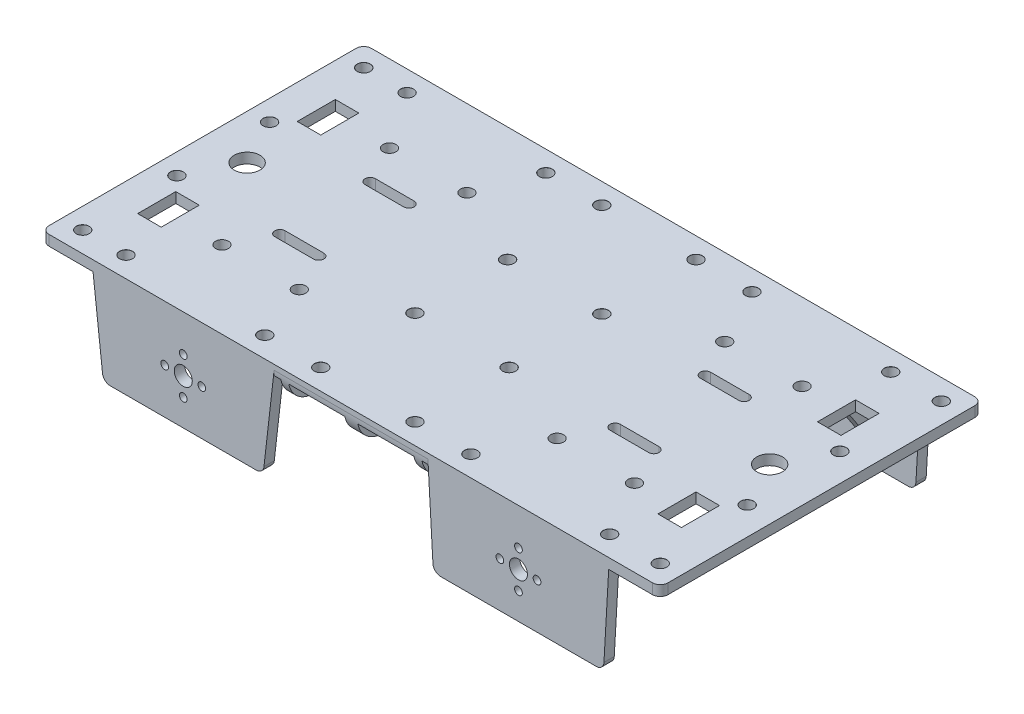
from build123d import *

# Parameters (mm, degrees)
EXTRUDE_1_DEPTH                 = 4
EXTRUDE_1_DEPTH_BACK            = 0.001
SKETCH_2_W                      = 240
SKETCH_2_H                      = 125
FILLET_1_R                      = 3
SKETCH_4_W                      = 70
SKETCH_4_H                      = 4
EXTRUDE_3_DEPTH                 = 35
CUT_EXTRUDE_1_DEPTH             = 177.776893289
CUT_EXTRUDE_1_DEPTH_BACK        = 177.776893289
CUT_EXTRUDE_2_DEPTH             = 177.776893289
CUT_EXTRUDE_2_DEPTH_BACK        = 177.776893289
FILLET_2_R                      = 3
FILLET_3_R                      = 3
CUT_EXTRUDE_4_REACH             = 142.81
SKETCH_11_R                     = 2.5
CUT_EXTRUDE_4_DIRECTION_2_DEPTH = 141.809545135
HOLE_WIZARD_5_0_5_4_D           = 5
HOLE_WIZARD_5_0_5_4_CSINK_D     = 5.05
HOLE_WIZARD_5_0_5_4_CSINK_ANGLE = 90
HOLE_WIZARD_5_0_5_5_D           = 5
HOLE_WIZARD_5_0_5_5_CSINK_D     = 5.05
HOLE_WIZARD_5_0_5_5_CSINK_ANGLE = 90
SKETCH_26_W                     = 9.130018581
SKETCH_26_H                     = 14.776214284
CUT_EXTRUDE_5_DEPTH             = 10
SKETCH_22_R                     = 5
CUT_EXTRUDE_6_DEPTH             = 10
SKETCH_29_R                     = 3.5
SKETCH_29_R_2                   = 1.5
CUT_EXTRUDE_7_DEPTH             = 177.776893289
SKETCH_30_W                     = 3.603756025
SKETCH_30_H                     = 19.855762593
EXTRUDE_4_DEPTH                 = 30
CUT_EXTRUDE_8_REACH             = 221.279
MIRROR_6_COPY_1_SKETCH_W        = 3.603756025
MIRROR_6_COPY_1_SKETCH_H        = 19.855762593
MIRROR_6_COPY_1_DEPTH           = 30
MIRROR_6_COPY_2_REACH           = 221.279
MIRROR_7_COPY_1_SKETCH_W        = 3.603756025
MIRROR_7_COPY_1_SKETCH_H        = 19.855762593
MIRROR_7_COPY_1_DEPTH           = 30
MIRROR_7_COPY_2_REACH           = 221.279
MIRROR_7_COPY_3_SKETCH_W        = 3.603756025
MIRROR_7_COPY_3_SKETCH_H        = 19.855762593
MIRROR_7_COPY_3_DEPTH           = 30
MIRROR_7_COPY_4_REACH           = 221.279
MIRROR_7_COPY_5_SKETCH_W        = 3.603756025
MIRROR_7_COPY_5_SKETCH_H        = 19.855762593
MIRROR_7_COPY_5_DEPTH           = 30
MIRROR_7_COPY_6_REACH           = 221.279
SKETCH_33_W                     = 5.04731896
SKETCH_33_H                     = 125
SKETCH_33_W_2                   = 3.106042459
EXTRUDE_5_DEPTH                 = 8
FILLET_4_R                      = 10


with BuildPart() as part:
    # 草图2 → 凸台-拉伸1 (new, two sides: drawn at the far end of the back side and taken through both)
    with BuildSketch(Plane(origin=(0, 0, 0), x_dir=(1, 0, 0), z_dir=(0, 1, 0)).offset(-EXTRUDE_1_DEPTH_BACK)):
        Rectangle(SKETCH_2_W, SKETCH_2_H)
    extrude(amount=EXTRUDE_1_DEPTH + EXTRUDE_1_DEPTH_BACK)

    # 圆角1
    fillet_1_edges = [part.edges().sort_by_distance(p)[0] for p in [
        (120, 1.9995, 62.5),
        (-120, 1.9995, 62.5),
        (-120, 1.9995, -62.5),
        (120, 1.9995, -62.5),
    ]]
    fillet(fillet_1_edges, radius=FILLET_1_R)

    # 草图4 → 凸台-拉伸3 (add)
    with BuildSketch(Plane.XZ.offset(0.001)):
        with Locations((65, 60.5)):
            Rectangle(SKETCH_4_W, SKETCH_4_H)
        with Locations((-65, 60.5)):
            Rectangle(SKETCH_4_W, SKETCH_4_H)
        with Locations((65, -60.5)):
            Rectangle(SKETCH_4_W, SKETCH_4_H)
        with Locations((-65, -60.5)):
            Rectangle(SKETCH_4_W, SKETCH_4_H)
    extrude(amount=EXTRUDE_3_DEPTH)

    # 草图7 → 切除-拉伸1 (cut, two sides: drawn at the far end of the back side and taken through both)
    with BuildSketch(Plane.XY.offset(62.5).offset(-CUT_EXTRUDE_1_DEPTH_BACK)):
        Polygon((-100, -0.001), (-96, -35.001), (-100, -35.001), align=None)
        Polygon((-30, -0.001), (-34, -35.001), (-30, -35.001), align=None)
    extrude(amount=CUT_EXTRUDE_1_DEPTH + CUT_EXTRUDE_1_DEPTH_BACK, mode=Mode.SUBTRACT)

    # 草图9 → 切除-拉伸2 (cut, two sides: drawn at the far end of the back side and taken through both)
    with BuildSketch(Plane.XY.offset(62.5).offset(-CUT_EXTRUDE_2_DEPTH_BACK)):
        Polygon((30, -0.001), (32, -35.001), (30, -35.001), align=None)
        Polygon((98, -35.001), (100, -35.001), (100, -0.001), align=None)
    extrude(amount=CUT_EXTRUDE_2_DEPTH + CUT_EXTRUDE_2_DEPTH_BACK, mode=Mode.SUBTRACT)

    # 圆角2
    fillet_2_edges = [part.edges().sort_by_distance(p)[0] for p in [
        (-96, -35.001, 60.5),
    ]]
    fillet(fillet_2_edges, radius=FILLET_2_R)

    # 圆角3
    fillet_3_edges = [part.edges().sort_by_distance(p)[0] for p in [
        (98, -35.001, -60.5),
        (32, -35.001, -60.5),
        (98, -35.001, 60.5),
        (32, -35.001, 60.5),
        (-34, -35.001, -60.5),
        (-96, -35.001, -60.5),
        (-34, -35.001, 60.5),
    ]]
    fillet(fillet_3_edges, radius=FILLET_3_R)

    # 草图11 → 切除-拉伸4 (cut, up to next)
    with BuildSketch(Plane(origin=(0, 4, 0), x_dir=(1, 0, 0), z_dir=(0, 1, 0)), mode=Mode.PRIVATE) as cut_extrude_4_sk1:
        with Locations(Location((-80, -32.5, 0), (0, 0, 90))):
            Circle(SKETCH_11_R)
    cut_extrude_4_tool1 = extrude(cut_extrude_4_sk1.sketch, amount=-CUT_EXTRUDE_4_REACH, mode=Mode.PRIVATE) & part.part
    # 草图11 → 切除-拉伸4 (cut, up to next)
    with BuildSketch(Plane(origin=(0, 4, 0), x_dir=(1, 0, 0), z_dir=(0, 1, 0)), mode=Mode.PRIVATE) as cut_extrude_4_sk2:
        with Locations(Location((-50, -32.5, 0), (0, 0, 90))):
            Circle(SKETCH_11_R)
    cut_extrude_4_tool2 = extrude(cut_extrude_4_sk2.sketch, amount=-CUT_EXTRUDE_4_REACH, mode=Mode.PRIVATE) & part.part
    # 草图11 → 切除-拉伸4 (cut, up to next)
    with BuildSketch(Plane(origin=(0, 4, 0), x_dir=(1, 0, 0), z_dir=(0, 1, 0)), mode=Mode.PRIVATE) as cut_extrude_4_sk3:
        with Locations(Location((-50, 32.5, 0), (0, 0, 90))):
            Circle(SKETCH_11_R)
    cut_extrude_4_tool3 = extrude(cut_extrude_4_sk3.sketch, amount=-CUT_EXTRUDE_4_REACH, mode=Mode.PRIVATE) & part.part
    # 草图11 → 切除-拉伸4 (cut, up to next)
    with BuildSketch(Plane(origin=(0, 4, 0), x_dir=(1, 0, 0), z_dir=(0, 1, 0)), mode=Mode.PRIVATE) as cut_extrude_4_sk4:
        with Locations(Location((-80, 32.5, 0), (0, 0, 90))):
            Circle(SKETCH_11_R)
    cut_extrude_4_tool4 = extrude(cut_extrude_4_sk4.sketch, amount=-CUT_EXTRUDE_4_REACH, mode=Mode.PRIVATE) & part.part
    # 草图11 → 切除-拉伸4 (cut, up to next)
    with BuildSketch(Plane(origin=(0, 4, 0), x_dir=(1, 0, 0), z_dir=(0, 1, 0)), mode=Mode.PRIVATE) as cut_extrude_4_sk5:
        with Locations(Location((50, -32.5, 0), (0, 0, 90))):
            Circle(SKETCH_11_R)
    cut_extrude_4_tool5 = extrude(cut_extrude_4_sk5.sketch, amount=-CUT_EXTRUDE_4_REACH, mode=Mode.PRIVATE) & part.part
    # 草图11 → 切除-拉伸4 (cut, up to next)
    with BuildSketch(Plane(origin=(0, 4, 0), x_dir=(1, 0, 0), z_dir=(0, 1, 0)), mode=Mode.PRIVATE) as cut_extrude_4_sk6:
        with Locations(Location((50, 32.5, 0), (0, 0, 90))):
            Circle(SKETCH_11_R)
    cut_extrude_4_tool6 = extrude(cut_extrude_4_sk6.sketch, amount=-CUT_EXTRUDE_4_REACH, mode=Mode.PRIVATE) & part.part
    # 草图11 → 切除-拉伸4 (cut, up to next)
    with BuildSketch(Plane(origin=(0, 4, 0), x_dir=(1, 0, 0), z_dir=(0, 1, 0)), mode=Mode.PRIVATE) as cut_extrude_4_sk7:
        with Locations(Location((80, -32.5, 0), (0, 0, 90))):
            Circle(SKETCH_11_R)
    cut_extrude_4_tool7 = extrude(cut_extrude_4_sk7.sketch, amount=-CUT_EXTRUDE_4_REACH, mode=Mode.PRIVATE) & part.part
    # 草图11 → 切除-拉伸4 (cut, up to next)
    with BuildSketch(Plane(origin=(0, 4, 0), x_dir=(1, 0, 0), z_dir=(0, 1, 0)), mode=Mode.PRIVATE) as cut_extrude_4_sk8:
        with Locations(Location((80, 32.5, 0), (0, 0, 90))):
            Circle(SKETCH_11_R)
    cut_extrude_4_tool8 = extrude(cut_extrude_4_sk8.sketch, amount=-CUT_EXTRUDE_4_REACH, mode=Mode.PRIVATE) & part.part
    # 草图11 → 切除-拉伸4 (cut, up to next)
    with BuildSketch(Plane(origin=(0, 4, 0), x_dir=(1, 0, 0), z_dir=(0, 1, 0)), mode=Mode.PRIVATE) as cut_extrude_4_sk9:
        with BuildLine():
            Line((-72.5, -15.5), (-57.5, -15.5))
            ThreePointArc((-57.5, -15.5), (-55.5, -17.5), (-57.5, -19.5))
            Line((-57.5, -19.5), (-72.5, -19.5))
            ThreePointArc((-72.5, -19.5), (-74.5, -17.5), (-72.5, -15.5))
        make_face()
    cut_extrude_4_tool9 = extrude(cut_extrude_4_sk9.sketch, amount=-CUT_EXTRUDE_4_REACH, mode=Mode.PRIVATE) & part.part
    # 草图11 → 切除-拉伸4 (cut, up to next)
    with BuildSketch(Plane(origin=(0, 4, 0), x_dir=(1, 0, 0), z_dir=(0, 1, 0)), mode=Mode.PRIVATE) as cut_extrude_4_sk10:
        with BuildLine():
            Line((-72.5, 15.5), (-57.5, 15.5))
            ThreePointArc((-57.5, 15.5), (-55.5, 17.5), (-57.5, 19.5))
            Line((-57.5, 19.5), (-72.5, 19.5))
            ThreePointArc((-72.5, 19.5), (-74.5, 17.5), (-72.5, 15.5))
        make_face()
    cut_extrude_4_tool10 = extrude(cut_extrude_4_sk10.sketch, amount=-CUT_EXTRUDE_4_REACH, mode=Mode.PRIVATE) & part.part
    # 草图11 → 切除-拉伸4 (cut, up to next)
    with BuildSketch(Plane(origin=(0, 4, 0), x_dir=(1, 0, 0), z_dir=(0, 1, 0)), mode=Mode.PRIVATE) as cut_extrude_4_sk11:
        with BuildLine():
            Line((72.5, -15.5), (57.5, -15.5))
            ThreePointArc((57.5, -15.5), (55.5, -17.5), (57.5, -19.5))
            Line((57.5, -19.5), (72.5, -19.5))
            ThreePointArc((72.5, -19.5), (74.5, -17.5), (72.5, -15.5))
        make_face()
    cut_extrude_4_tool11 = extrude(cut_extrude_4_sk11.sketch, amount=-CUT_EXTRUDE_4_REACH, mode=Mode.PRIVATE) & part.part
    # 草图11 → 切除-拉伸4 (cut, up to next)
    with BuildSketch(Plane(origin=(0, 4, 0), x_dir=(1, 0, 0), z_dir=(0, 1, 0)), mode=Mode.PRIVATE) as cut_extrude_4_sk12:
        with BuildLine():
            Line((72.5, 15.5), (57.5, 15.5))
            ThreePointArc((57.5, 15.5), (55.5, 17.5), (57.5, 19.5))
            Line((57.5, 19.5), (72.5, 19.5))
            ThreePointArc((72.5, 19.5), (74.5, 17.5), (72.5, 15.5))
        make_face()
    cut_extrude_4_tool12 = extrude(cut_extrude_4_sk12.sketch, amount=-CUT_EXTRUDE_4_REACH, mode=Mode.PRIVATE) & part.part
    add(cut_extrude_4_tool1.solids().sort_by_distance((-80, 4, 32.5))[0], mode=Mode.SUBTRACT)
    add(cut_extrude_4_tool2.solids().sort_by_distance((-50, 4, 32.5))[0], mode=Mode.SUBTRACT)
    add(cut_extrude_4_tool3.solids().sort_by_distance((-50, 4, -32.5))[0], mode=Mode.SUBTRACT)
    add(cut_extrude_4_tool4.solids().sort_by_distance((-80, 4, -32.5))[0], mode=Mode.SUBTRACT)
    add(cut_extrude_4_tool5.solids().sort_by_distance((50, 4, 32.5))[0], mode=Mode.SUBTRACT)
    add(cut_extrude_4_tool6.solids().sort_by_distance((50, 4, -32.5))[0], mode=Mode.SUBTRACT)
    add(cut_extrude_4_tool7.solids().sort_by_distance((80, 4, 32.5))[0], mode=Mode.SUBTRACT)
    add(cut_extrude_4_tool8.solids().sort_by_distance((80, 4, -32.5))[0], mode=Mode.SUBTRACT)
    add(cut_extrude_4_tool9.solids().sort_by_distance((-65, 4, 17.5))[0], mode=Mode.SUBTRACT)
    add(cut_extrude_4_tool10.solids().sort_by_distance((-65, 4, -17.5))[0], mode=Mode.SUBTRACT)
    add(cut_extrude_4_tool11.solids().sort_by_distance((65, 4, 17.5))[0], mode=Mode.SUBTRACT)
    add(cut_extrude_4_tool12.solids().sort_by_distance((65, 4, -17.5))[0], mode=Mode.SUBTRACT)

    # 草图11 → 切除-拉伸4 direction 2 (cut)
    with BuildSketch(Plane(origin=(0, 4, 0), x_dir=(1, 0, 0), z_dir=(0, 1, 0))):
        with Locations(Location((-80, -32.5, 0), (0, 0, 90))):
            Circle(SKETCH_11_R)
        with Locations(Location((-50, -32.5, 0), (0, 0, 90))):
            Circle(SKETCH_11_R)
        with Locations(Location((-50, 32.5, 0), (0, 0, 90))):
            Circle(SKETCH_11_R)
        with Locations(Location((-80, 32.5, 0), (0, 0, 90))):
            Circle(SKETCH_11_R)
        with Locations(Location((50, -32.5, 0), (0, 0, 90))):
            Circle(SKETCH_11_R)
        with Locations(Location((50, 32.5, 0), (0, 0, 90))):
            Circle(SKETCH_11_R)
        with Locations(Location((80, -32.5, 0), (0, 0, 90))):
            Circle(SKETCH_11_R)
        with Locations(Location((80, 32.5, 0), (0, 0, 90))):
            Circle(SKETCH_11_R)
        with BuildLine():
            Line((-72.5, -15.5), (-57.5, -15.5))
            ThreePointArc((-57.5, -15.5), (-55.5, -17.5), (-57.5, -19.5))
            Line((-57.5, -19.5), (-72.5, -19.5))
            ThreePointArc((-72.5, -19.5), (-74.5, -17.5), (-72.5, -15.5))
        make_face()
        with BuildLine():
            Line((-72.5, 15.5), (-57.5, 15.5))
            ThreePointArc((-57.5, 15.5), (-55.5, 17.5), (-57.5, 19.5))
            Line((-57.5, 19.5), (-72.5, 19.5))
            ThreePointArc((-72.5, 19.5), (-74.5, 17.5), (-72.5, 15.5))
        make_face()
        with BuildLine():
            Line((72.5, -15.5), (57.5, -15.5))
            ThreePointArc((57.5, -15.5), (55.5, -17.5), (57.5, -19.5))
            Line((57.5, -19.5), (72.5, -19.5))
            ThreePointArc((72.5, -19.5), (74.5, -17.5), (72.5, -15.5))
        make_face()
        with BuildLine():
            Line((72.5, 15.5), (57.5, 15.5))
            ThreePointArc((57.5, 15.5), (55.5, 17.5), (57.5, 19.5))
            Line((57.5, 19.5), (72.5, 19.5))
            ThreePointArc((72.5, 19.5), (74.5, 17.5), (72.5, 15.5))
        make_face()
    extrude(amount=CUT_EXTRUDE_4_DIRECTION_2_DEPTH, mode=Mode.SUBTRACT)

    # Ø5.0 (5) 直径孔4 (through all)
    with Locations(Plane(origin=(0, 4, 0), x_dir=(1, 0, 0), z_dir=(0, 1, 0))):
        with Locations((-112, 54.5), (-112, -54.5), (112, -54.5), (112, 54.5)):
            CounterSinkHole(HOLE_WIZARD_5_0_5_4_D / 2, HOLE_WIZARD_5_0_5_4_CSINK_D / 2, counter_sink_angle=HOLE_WIZARD_5_0_5_4_CSINK_ANGLE)

    # Ø5.0 (5) 直径孔5 (through all)
    with Locations(Plane(origin=(0, 4, 0), x_dir=(1, 0, 0), z_dir=(0, 1, 0))):
        with Locations((-95.192123364, 54.5), (-41.370416483, 54.5), (-19.681071919, 54.5), (-19.681071919, 17.973880171), (-112, 17.973880171), (-112, -17.973880171), (-95.192123364, -54.5), (-41.370416483, -54.5), (-19.681071919, -54.5), (-19.681071919, -17.973880171), (16.869490216, 17.973880171), (16.869490216, -17.973880171), (16.869490216, 54.5), (38.55883478, 54.5), (92.380541661, 54.5), (109.188418297, 17.973880171), (109.188418297, -17.973880171), (92.380541661, -54.5), (38.55883478, -54.5), (16.869490216, -54.5)):
            CounterSinkHole(HOLE_WIZARD_5_0_5_5_D / 2, HOLE_WIZARD_5_0_5_5_CSINK_D / 2, counter_sink_angle=HOLE_WIZARD_5_0_5_5_CSINK_ANGLE)

    # 草图26 → 切除-拉伸5 (cut)
    with BuildSketch(Plane(origin=(0, 4, 0), x_dir=(1, 0, 0), z_dir=(0, 1, 0))):
        with Locations((-102.29021779, 30.941404151)):
            Rectangle(SKETCH_26_W, SKETCH_26_H)
        with Locations((-102.29021779, -30.941404151)):
            Rectangle(SKETCH_26_W, SKETCH_26_H)
        with Locations((99.478636087, -30.941404151)):
            Rectangle(SKETCH_26_W, SKETCH_26_H)
        with Locations((99.478636087, 30.941404151)):
            Rectangle(SKETCH_26_W, SKETCH_26_H)
    extrude(amount=-CUT_EXTRUDE_5_DEPTH, mode=Mode.SUBTRACT)

    # 草图22 → 切除-拉伸6 (cut)
    with BuildSketch(Plane(origin=(0, 4, 0), x_dir=(1, 0, 0), z_dir=(0, 1, 0))):
        with Locations(Location((-102.73836527, 0, 0), (0, 0, 270))):
            Circle(SKETCH_22_R)
        with Locations(Location((99.926783567, 0, 0), (0, 0, 90))):
            Circle(SKETCH_22_R)
    extrude(amount=-CUT_EXTRUDE_6_DEPTH, mode=Mode.SUBTRACT)

    # 草图29 → 切除-拉伸7 (cut, through all)
    with BuildSketch(Plane.XY.offset(62.5)):
        with Locations((-65, -17.501)):
            Circle(SKETCH_29_R)
        with Locations((-65, -10.301)):
            Circle(SKETCH_29_R_2)
        with Locations((-57.8, -17.501)):
            Circle(SKETCH_29_R_2)
        with Locations((-65, -24.701)):
            Circle(SKETCH_29_R_2)
        with Locations((-72.2, -17.501)):
            Circle(SKETCH_29_R_2)
        with Locations(Location((57.8, -17.501, 0), (0, 0, 180))):
            Circle(SKETCH_29_R_2)
        with Locations(Location((72.2, -17.501, 0), (0, 0, 180))):
            Circle(SKETCH_29_R_2)
        with Locations(Location((65, -24.701, 0), (0, 0, 180))):
            Circle(SKETCH_29_R_2)
        with Locations(Location((65, -17.501, 0), (0, 0, 180))):
            Circle(SKETCH_29_R)
        with Locations(Location((65, -10.301, 0), (0, 0, 180))):
            Circle(SKETCH_29_R_2)
    extrude(amount=-CUT_EXTRUDE_7_DEPTH, mode=Mode.SUBTRACT)

    # 草图30 → 凸台-拉伸4 (add)
    with BuildSketch(Plane.XZ.offset(0.001)):
        with Locations((85.446952063, -48.572118704)):
            Rectangle(SKETCH_30_W, SKETCH_30_H)
    extrude_4 = extrude(amount=EXTRUDE_4_DEPTH)

    # 草图31 → 切除-拉伸8 (cut, up to next)
    with BuildSketch(Plane(origin=(87.248830075, 0, 0), x_dir=(0, 0, -1), z_dir=(1, 0, 0)), mode=Mode.PRIVATE) as cut_extrude_8_sk1:
        Polygon((38.644237407, -0.001), (58.5, -30.001), (38.644237407, -30.001), align=None)
    cut_extrude_8_tool1 = extrude(cut_extrude_8_sk1.sketch, amount=-CUT_EXTRUDE_8_REACH, mode=Mode.PRIVATE) & part.part
    cut_extrude_8 = cut_extrude_8_tool1.solids().sort_by_distance((87.24883, -20.001, -45.262825))[0]
    add(cut_extrude_8, mode=Mode.SUBTRACT)

    # 镜向1: 切除-拉伸8 across plane
    add(cut_extrude_8.mirror(Plane.ZY.offset(-65)), mode=Mode.SUBTRACT)

    # 镜向2: 凸台-拉伸4 across plane
    add(extrude_4.mirror(Plane.ZY.offset(-65)))

    # 镜向4: 切除-拉伸8 across plane
    add(cut_extrude_8.mirror(Plane.ZY.offset(-65)), mode=Mode.SUBTRACT)

    # 镜向6: 凸台-拉伸4, 切除-拉伸8 across plane
    add(extrude_4.mirror(Plane(origin=(0, 0, 0), x_dir=(0, 0, 1), z_dir=(1, 0, 0))))
    add(cut_extrude_8.mirror(Plane(origin=(0, 0, 0), x_dir=(0, 0, 1), z_dir=(1, 0, 0))), mode=Mode.SUBTRACT)

    # 镜向6 copy 1 sketch → 镜向6 copy 1 (add)
    with BuildSketch(Plane(origin=(-130, -0.001, 0), x_dir=(1, 0, 0), z_dir=(0, -1, 0))):
        with Locations((85.446952063, -48.572118704)):
            Rectangle(MIRROR_6_COPY_1_SKETCH_W, MIRROR_6_COPY_1_SKETCH_H)
    extrude(amount=MIRROR_6_COPY_1_DEPTH)

    # 镜向6 copy 2 sketch → 镜向6 copy 2 (cut, up to next)
    with BuildSketch(Plane(origin=(-42.751169925, 0, 0), x_dir=(0, 0, -1), z_dir=(1, 0, 0)), mode=Mode.PRIVATE) as mirror_6_copy_2_sk1:
        Polygon((38.644237407, -0.001), (58.5, -30.001), (38.644237407, -30.001), align=None)
    mirror_6_copy_2_tool1 = extrude(mirror_6_copy_2_sk1.sketch, amount=-MIRROR_6_COPY_2_REACH, mode=Mode.PRIVATE) & part.part
    add(mirror_6_copy_2_tool1.solids().sort_by_distance((-42.75117, -20.001, -45.262825))[0], mode=Mode.SUBTRACT)

    # 镜向7: 凸台-拉伸4, 切除-拉伸8 across plane
    add(extrude_4.mirror(Plane.XY))
    add(cut_extrude_8.mirror(Plane.XY), mode=Mode.SUBTRACT)

    # 镜向7 copy 1 sketch → 镜向7 copy 1 (add)
    with BuildSketch(Plane(origin=(130, -0.001, 0), x_dir=(-1, 0, 0), z_dir=(0, -1, 0))):
        with Locations((85.446952063, -48.572118704)):
            Rectangle(MIRROR_7_COPY_1_SKETCH_W, MIRROR_7_COPY_1_SKETCH_H)
    extrude(amount=MIRROR_7_COPY_1_DEPTH)

    # 镜向7 copy 2 sketch → 镜向7 copy 2 (cut, up to next)
    with BuildSketch(Plane.ZY.offset(-42.751169925), mode=Mode.PRIVATE) as mirror_7_copy_2_sk1:
        Polygon((38.644237407, -0.001), (58.5, -30.001), (38.644237407, -30.001), align=None)
    mirror_7_copy_2_tool1 = extrude(mirror_7_copy_2_sk1.sketch, amount=-MIRROR_7_COPY_2_REACH, mode=Mode.PRIVATE) & part.part
    add(mirror_7_copy_2_tool1.solids().sort_by_distance((42.75117, -20.001, 45.262825))[0], mode=Mode.SUBTRACT)

    # 镜向7 copy 3 sketch → 镜向7 copy 3 (add)
    with BuildSketch(Plane(origin=(0, -0.001, 0), x_dir=(-1, 0, 0), z_dir=(0, -1, 0))):
        with Locations((85.446952063, -48.572118704)):
            Rectangle(MIRROR_7_COPY_3_SKETCH_W, MIRROR_7_COPY_3_SKETCH_H)
    extrude(amount=MIRROR_7_COPY_3_DEPTH)

    # 镜向7 copy 4 sketch → 镜向7 copy 4 (cut, up to next)
    with BuildSketch(Plane.ZY.offset(87.248830075), mode=Mode.PRIVATE) as mirror_7_copy_4_sk1:
        Polygon((38.644237407, -0.001), (58.5, -30.001), (38.644237407, -30.001), align=None)
    mirror_7_copy_4_tool1 = extrude(mirror_7_copy_4_sk1.sketch, amount=-MIRROR_7_COPY_4_REACH, mode=Mode.PRIVATE) & part.part
    add(mirror_7_copy_4_tool1.solids().sort_by_distance((-87.24883, -20.001, 45.262825))[0], mode=Mode.SUBTRACT)

    # 镜向7 copy 5 sketch → 镜向7 copy 5 (add)
    with BuildSketch(Plane(origin=(-130, -0.001, 0), x_dir=(1, 0, 0), z_dir=(0, -1, 0))):
        with Locations((85.446952063, 48.572118704)):
            Rectangle(MIRROR_7_COPY_5_SKETCH_W, MIRROR_7_COPY_5_SKETCH_H)
    extrude(amount=MIRROR_7_COPY_5_DEPTH)

    # 镜向7 copy 6 sketch → 镜向7 copy 6 (cut, up to next)
    with BuildSketch(Plane(origin=(-42.751169925, 0, 0), x_dir=(0, 0, 1), z_dir=(1, 0, 0)), mode=Mode.PRIVATE) as mirror_7_copy_6_sk1:
        Polygon((38.644237407, 0.001), (58.5, 30.001), (38.644237407, 30.001), align=None)
    mirror_7_copy_6_tool1 = extrude(mirror_7_copy_6_sk1.sketch, amount=-MIRROR_7_COPY_6_REACH, mode=Mode.PRIVATE) & part.part
    add(mirror_7_copy_6_tool1.solids().sort_by_distance((-42.75117, -20.001, 45.262825))[0], mode=Mode.SUBTRACT)

    # 草图33 → 凸台-拉伸5 (add)
    with BuildSketch(Plane.XZ.offset(0.001)):
        Rectangle(SKETCH_33_W, SKETCH_33_H)
        with Locations((-25.818978009, 0)):
            Rectangle(SKETCH_33_W_2, SKETCH_33_H)
        with Locations((25.818978009, 0)):
            Rectangle(SKETCH_33_W_2, SKETCH_33_H)
    extrude(amount=EXTRUDE_5_DEPTH)

    # 圆角4
    # the kernel refuses this fillet: 10 mm, written as the material it takes off along each edge
    with BuildSketch(Plane(origin=(0.734043221, -8.001, 62.5), x_dir=(0, 1, 0), z_dir=(-1, 0, 0))) as fillet_4_piece_1_section:
        with BuildLine():
            CenterArc((FILLET_4_R, FILLET_4_R), FILLET_4_R, 180, 90)
            Line((0, FILLET_4_R), (0, 0))
            Line((0, 0), (FILLET_4_R, 0))
        make_face()
    fillet_4_piece_1 = extrude(amount=53.106042459, mode=Mode.PRIVATE)
    fillet_4_piece_1 = split(fillet_4_piece_1, bisect_by=Plane(origin=(-29.568460223, 3.774973052, 62.439494123), z_dir=(0.9935326726564041, -0.11354659116073348, 0)), keep=Keep.TOP, mode=Mode.PRIVATE)
    add(fillet_4_piece_1, mode=Mode.SUBTRACT)
    with BuildSketch(Plane(origin=(-52.371999238, -8.001, -62.5), x_dir=(0, 1, 0), z_dir=(1, 0, 0))) as fillet_4_piece_2_section:
        with BuildLine():
            CenterArc((FILLET_4_R, FILLET_4_R), FILLET_4_R, 180, 90)
            Line((0, FILLET_4_R), (0, 0))
            Line((0, 0), (FILLET_4_R, 0))
        make_face()
    fillet_4_piece_2 = extrude(amount=53.106042459, mode=Mode.PRIVATE)
    fillet_4_piece_2 = split(fillet_4_piece_2, bisect_by=Plane(origin=(-29.927155481, 0.63638954, -62.439045327), z_dir=(0.9935326726564041, -0.11354659116073348, 0)), keep=Keep.TOP, mode=Mode.PRIVATE)
    add(fillet_4_piece_2, mode=Mode.SUBTRACT)
    with BuildSketch(Plane(origin=(-27.52365948, -8.001, -62.5), x_dir=(0, 1, 0), z_dir=(1, 0, 0)), Plane(origin=(27.52365948, -8.001, 62.5), x_dir=(0, 1, 0), z_dir=(-1, 0, 0))) as fillet_4_piece_3:
        with BuildLine():
            CenterArc((FILLET_4_R, FILLET_4_R), FILLET_4_R, 180, 90)
            Line((0, FILLET_4_R), (0, 0))
            Line((0, 0), (FILLET_4_R, 0))
        make_face()
    extrude(amount=55.047318961, mode=Mode.SUBTRACT)
    with BuildSketch(Plane(origin=(52.371999238, -8.001, -62.5), x_dir=(0, 1, 0), z_dir=(-1, 0, 0))) as fillet_4_piece_4_section:
        with BuildLine():
            CenterArc((FILLET_4_R, -FILLET_4_R), FILLET_4_R, 90, 90)
            Line((0, -FILLET_4_R), (0, 0))
            Line((0, 0), (FILLET_4_R, 0))
        make_face()
    fillet_4_piece_4 = extrude(amount=53.106042459, mode=Mode.PRIVATE)
    fillet_4_piece_4 = split(fillet_4_piece_4, bisect_by=Plane(origin=(29.967444154, 0.568727299, -62.439272187), z_dir=(-0.9983713344239767, -0.05704979053851253, 0)), keep=Keep.TOP, mode=Mode.PRIVATE)
    add(fillet_4_piece_4, mode=Mode.SUBTRACT)
    with BuildSketch(Plane(origin=(-0.734043221, -8.001, 62.5), x_dir=(0, 1, 0), z_dir=(1, 0, 0))) as fillet_4_piece_5_section:
        with BuildLine():
            CenterArc((FILLET_4_R, -FILLET_4_R), FILLET_4_R, 90, 90)
            Line((0, -FILLET_4_R), (0, 0))
            Line((0, 0), (FILLET_4_R, 0))
        make_face()
    fillet_4_piece_5 = extrude(amount=53.106042459, mode=Mode.PRIVATE)
    fillet_4_piece_5 = split(fillet_4_piece_5, bisect_by=Plane(origin=(29.876851372, 2.154100998, 62.439494123), z_dir=(-0.9983713344239767, -0.05704979053851253, 0)), keep=Keep.TOP, mode=Mode.PRIVATE)
    add(fillet_4_piece_5, mode=Mode.SUBTRACT)


solid = part.part
